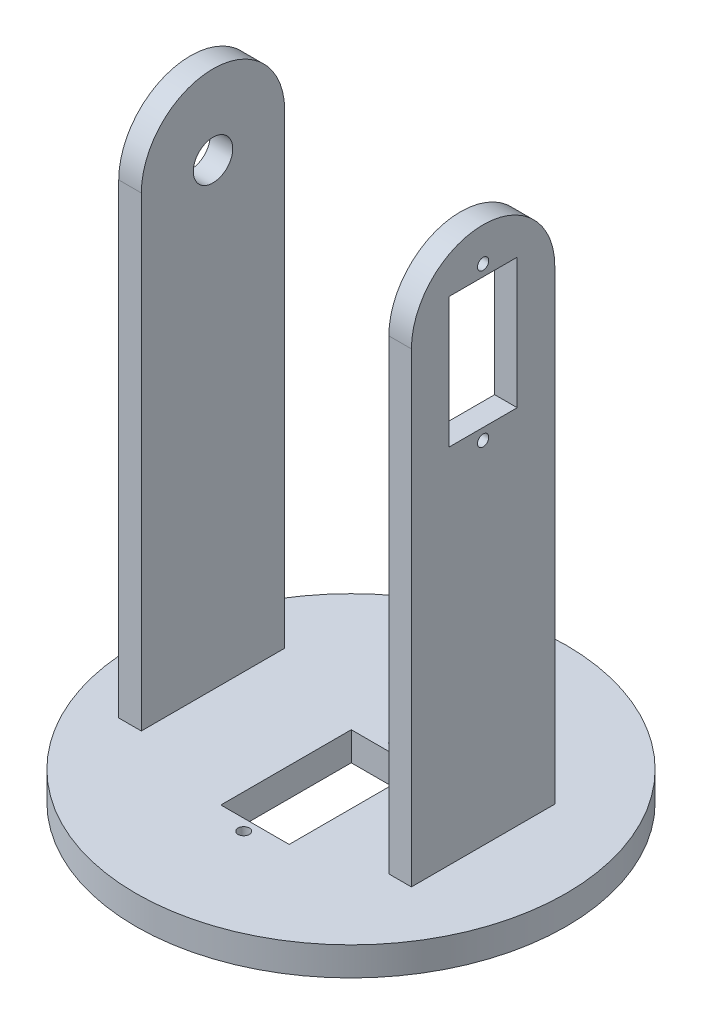
from build123d import *

# Parameters (mm, degrees)
SKETCH1_R           = 38.1
BOSS_EXTRUDE1_DEPTH = 5.08
SKETCH2_W           = 4
SKETCH2_H           = 25.4
BOSS_EXTRUDE2_DEPTH = 95.25
CUT_EXTRUDE2_REACH  = 125.693
SKETCH3_R           = 1
SKETCH3_W           = 12.1
SKETCH3_H           = 23.1
CUT_EXTRUDE3_DEPTH  = 124.693043054
CUT_EXTRUDE4_REACH  = 128.279
SKETCH5_R           = 3.5
CUT_EXTRUDE5_REACH  = 111.434
SKETCH6_R           = 1
SKETCH6_W           = 12.1
SKETCH6_H           = 23.1


with BuildPart() as part:
    # Sketch1 → Boss-Extrude1 (new body)
    with BuildSketch(Plane(origin=(0, 0, 0), x_dir=(1, 0, 0), z_dir=(0, 1, 0))):
        Circle(SKETCH1_R)
    extrude(amount=BOSS_EXTRUDE1_DEPTH)

    # Sketch2 → Boss-Extrude2 (add)
    with BuildSketch(Plane(origin=(0, 5.08, 0), x_dir=(1, 0, 0), z_dir=(0, 1, 0))):
        with Locations((-26.448, 0)):
            Rectangle(SKETCH2_W, SKETCH2_H)
        with Locations((21.4, 0)):
            Rectangle(SKETCH2_W, SKETCH2_H)
    extrude(amount=BOSS_EXTRUDE2_DEPTH)

    # Sketch3 → Cut-Extrude2 (cut, up to next)
    with BuildSketch(Plane(origin=(23.4, 0, 0), x_dir=(0, 0, -1), z_dir=(1, 0, 0)), mode=Mode.PRIVATE) as cut_extrude2_sk1:
        with Locations((0, 67.23)):
            Circle(SKETCH3_R)
    cut_extrude2_tool1 = extrude(cut_extrude2_sk1.sketch, amount=-CUT_EXTRUDE2_REACH, mode=Mode.PRIVATE) & part.part
    # Sketch3 → Cut-Extrude2 (cut, up to next)
    with BuildSketch(Plane(origin=(23.4, 0, 0), x_dir=(0, 0, -1), z_dir=(1, 0, 0)), mode=Mode.PRIVATE) as cut_extrude2_sk2:
        with Locations((0, 94.33)):
            Circle(SKETCH3_R)
    cut_extrude2_tool2 = extrude(cut_extrude2_sk2.sketch, amount=-CUT_EXTRUDE2_REACH, mode=Mode.PRIVATE) & part.part
    # Sketch3 → Cut-Extrude2 (cut, up to next)
    with BuildSketch(Plane(origin=(23.4, 0, 0), x_dir=(0, 0, -1), z_dir=(1, 0, 0)), mode=Mode.PRIVATE) as cut_extrude2_sk3:
        with Locations((0, 80.78)):
            Rectangle(SKETCH3_W, SKETCH3_H)
    cut_extrude2_tool3 = extrude(cut_extrude2_sk3.sketch, amount=-CUT_EXTRUDE2_REACH, mode=Mode.PRIVATE) & part.part
    add(cut_extrude2_tool1.solids().sort_by_distance((23.4, 67.23, 0))[0], mode=Mode.SUBTRACT)
    add(cut_extrude2_tool2.solids().sort_by_distance((23.4, 94.33, 0))[0], mode=Mode.SUBTRACT)
    add(cut_extrude2_tool3.solids().sort_by_distance((23.4, 80.78, 0))[0], mode=Mode.SUBTRACT)

    # Sketch4 → Cut-Extrude3 (cut, through all)
    with BuildSketch(Plane(origin=(23.4, 0, 0), x_dir=(0, 0, -1), z_dir=(1, 0, 0))):
        with BuildLine():
            Line((0, 100.33), (-12.7, 100.33))
            Line((-12.7, 100.33), (-12.7, 87.63))
            ThreePointArc((-12.7, 87.63), (-8.980256121, 96.610256121), (0, 100.33))
        make_face()
        with BuildLine():
            Line((12.7, 100.33), (0, 100.33))
            ThreePointArc((0, 100.33), (8.980256121, 96.610256121), (12.7, 87.63))
            Line((12.7, 87.63), (12.7, 100.33))
        make_face()
    extrude(amount=-CUT_EXTRUDE3_DEPTH, mode=Mode.SUBTRACT)

    # Sketch5 → Cut-Extrude4 (cut, up to next)
    with BuildSketch(Plane.ZY.offset(28.448), mode=Mode.PRIVATE) as cut_extrude4_sk1:
        with Locations((0, 86.33)):
            Circle(SKETCH5_R)
    cut_extrude4_tool1 = extrude(cut_extrude4_sk1.sketch, amount=-CUT_EXTRUDE4_REACH, mode=Mode.PRIVATE) & part.part
    add(cut_extrude4_tool1.solids().sort_by_distance((-28.448, 86.33, 0))[0], mode=Mode.SUBTRACT)

    # Sketch6 → Cut-Extrude5 (cut, up to next)
    with BuildSketch(Plane(origin=(0, 5.08, 0), x_dir=(1, 0, 0), z_dir=(0, 1, 0)), mode=Mode.PRIVATE) as cut_extrude5_sk1:
        with Locations((0, -19.004)):
            Circle(SKETCH6_R)
    cut_extrude5_tool1 = extrude(cut_extrude5_sk1.sketch, amount=-CUT_EXTRUDE5_REACH, mode=Mode.PRIVATE) & part.part
    # Sketch6 → Cut-Extrude5 (cut, up to next)
    with BuildSketch(Plane(origin=(0, 5.08, 0), x_dir=(1, 0, 0), z_dir=(0, 1, 0)), mode=Mode.PRIVATE) as cut_extrude5_sk2:
        with Locations((0, 8.096)):
            Circle(SKETCH6_R)
    cut_extrude5_tool2 = extrude(cut_extrude5_sk2.sketch, amount=-CUT_EXTRUDE5_REACH, mode=Mode.PRIVATE) & part.part
    # Sketch6 → Cut-Extrude5 (cut, up to next)
    with BuildSketch(Plane(origin=(0, 5.08, 0), x_dir=(1, 0, 0), z_dir=(0, 1, 0)), mode=Mode.PRIVATE) as cut_extrude5_sk3:
        with Locations((0, -5.454)):
            Rectangle(SKETCH6_W, SKETCH6_H)
    cut_extrude5_tool3 = extrude(cut_extrude5_sk3.sketch, amount=-CUT_EXTRUDE5_REACH, mode=Mode.PRIVATE) & part.part
    add(cut_extrude5_tool1.solids().sort_by_distance((0, 5.08, 19.004))[0], mode=Mode.SUBTRACT)
    add(cut_extrude5_tool2.solids().sort_by_distance((0, 5.08, -8.096))[0], mode=Mode.SUBTRACT)
    add(cut_extrude5_tool3.solids().sort_by_distance((0, 5.08, 5.454))[0], mode=Mode.SUBTRACT)


solid = part.part
